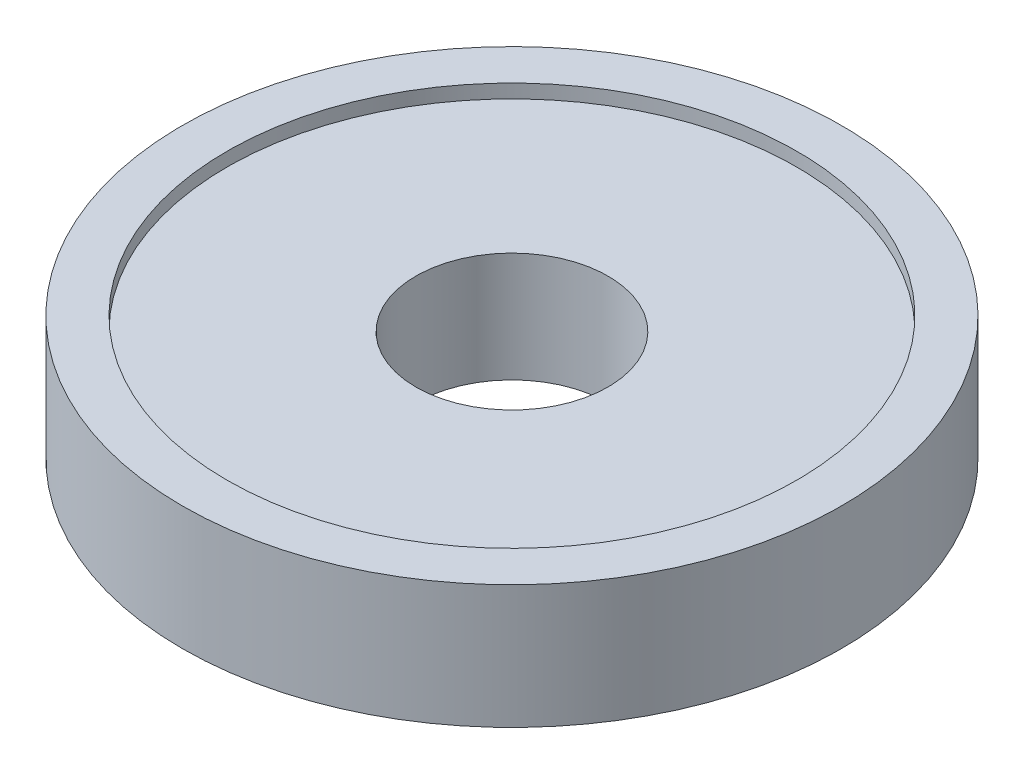
from build123d import *

# Parameters (mm, degrees)
SKETCH1_R           = 48
SKETCH1_R_2         = 14
BOSS_EXTRUDE1_DEPTH = 9
SKETCH4_R           = 41.5
CUT_EXTRUDE1_DEPTH  = 2


with BuildPart() as part:
    # Sketch1 → Boss-Extrude1 (new, symmetric)
    with BuildSketch(Plane(origin=(0, 0, 0), x_dir=(1, 0, 0), z_dir=(0, 1, 0))):
        Circle(SKETCH1_R)
        Circle(SKETCH1_R_2, mode=Mode.SUBTRACT)
    extrude(amount=BOSS_EXTRUDE1_DEPTH, both=True)

    # Sketch4 → Cut-Extrude1 (cut)
    with BuildSketch(Plane(origin=(0, 9, 0), x_dir=(1, 0, 0), z_dir=(0, 1, 0))):
        Circle(SKETCH4_R)
    extrude(amount=-CUT_EXTRUDE1_DEPTH, mode=Mode.SUBTRACT)


solid = part.part
